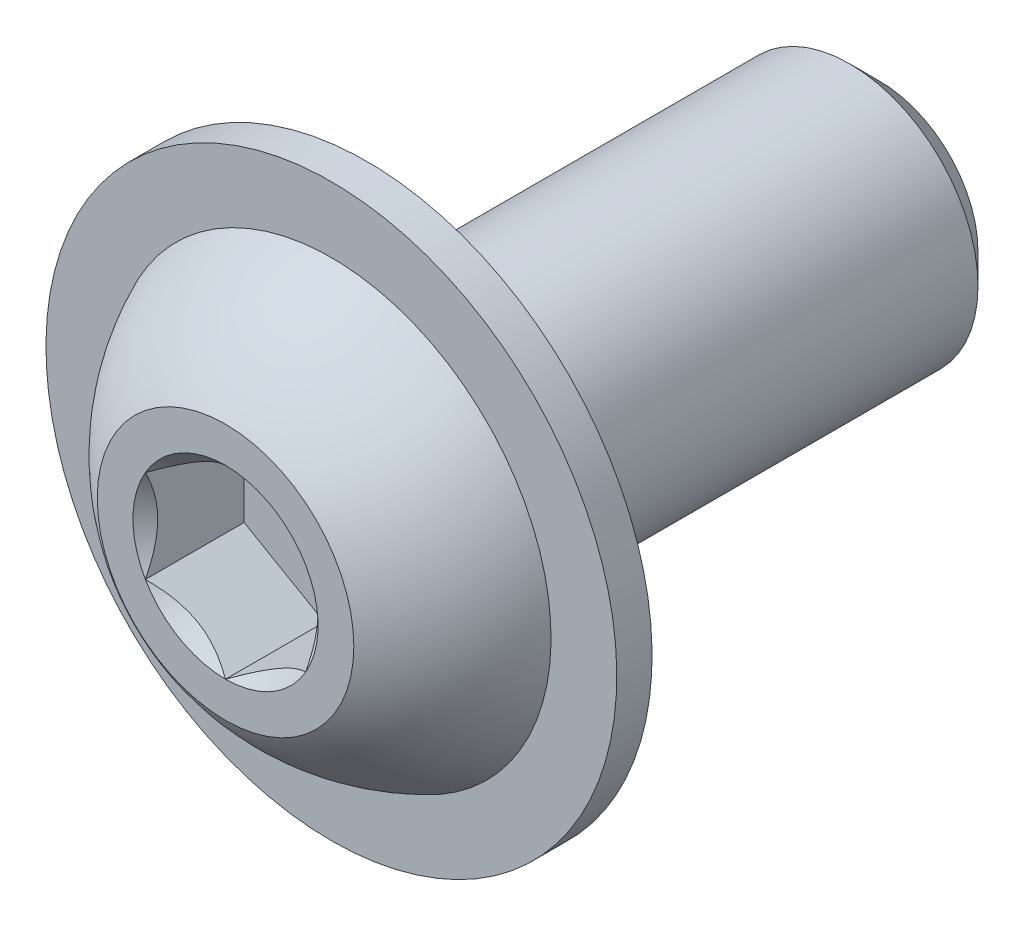
from build123d import *

# Parameters (mm, degrees)
SKETCH13_W         = 16
SKETCH13_H         = 4
CHAMFER1_SIZE      = 0.9375
CUT_EXTRUDE2_DEPTH = 3.08


with BuildPart() as part:
    # Sketch13 → Revolve1 (revolve)
    with BuildSketch(Plane(origin=(0, 0, 0), x_dir=(0, 0, -1), z_dir=(1, 0, 0))):
        with Locations((2.2, 2)):
            Rectangle(SKETCH13_W, SKETCH13_H)
    revolve(axis=Axis((0, 0, 10.2), (0, 0, -1)))

    # Chamfer1
    chamfer1_edges = [part.edges().sort_by_distance(p)[0] for p in [
        (0, -4, -10.2),
    ]]
    chamfer(chamfer1_edges, length=CHAMFER1_SIZE)

    # Sketch7 → Revolve2 (revolve)
    with BuildSketch(Plane(origin=(0, 0, 0), x_dir=(0, 0, -1), z_dir=(1, 0, 0))):
        with BuildLine():
            Line((-5.8, 6.85), (-5.8, 0))
            Line((-5.8, 0), (-10.2, 0))
            Line((-10.2, 0), (-10.2, 4))
            ThreePointArc((-10.2, 4), (-8.761912668, 5.670372563), (-6.9, 6.85))
            Line((-6.9, 6.85), (-6.9, 8.9))
            Line((-6.9, 8.9), (-5.8, 8.9))
            Line((-5.8, 8.9), (-5.8, 6.85))
        make_face()
    revolve(axis=Axis((0, 0, 10.2), (0, 0, -1)))

    # Sketch5 → Cut-Extrude2 (cut)
    with BuildSketch(Plane.XY.offset(10.2)):
        Polygon((2.5, -1.443375673), (2.5, 1.443375673), (0, 2.886751346), (-2.5, 1.443375673), (-2.5, -1.443375673), (0, -2.886751346), align=None)
    extrude(amount=-CUT_EXTRUDE2_DEPTH, mode=Mode.SUBTRACT)

    # Cut-Extrude3 cone 1 section (through the dimple's axis) → Cut-Extrude3 (revolve, cut)
    with BuildSketch(Plane(origin=(0, 0, 10.2), x_dir=(0, -1, 0), z_dir=(1, 0, 0))):
        Polygon((0, 0), (2.886751346, 0), (0, 2.886751346), align=None)
    revolve(axis=Axis((0, 0, 10.2), (0, 0, -1)), mode=Mode.SUBTRACT)


solid = part.part
